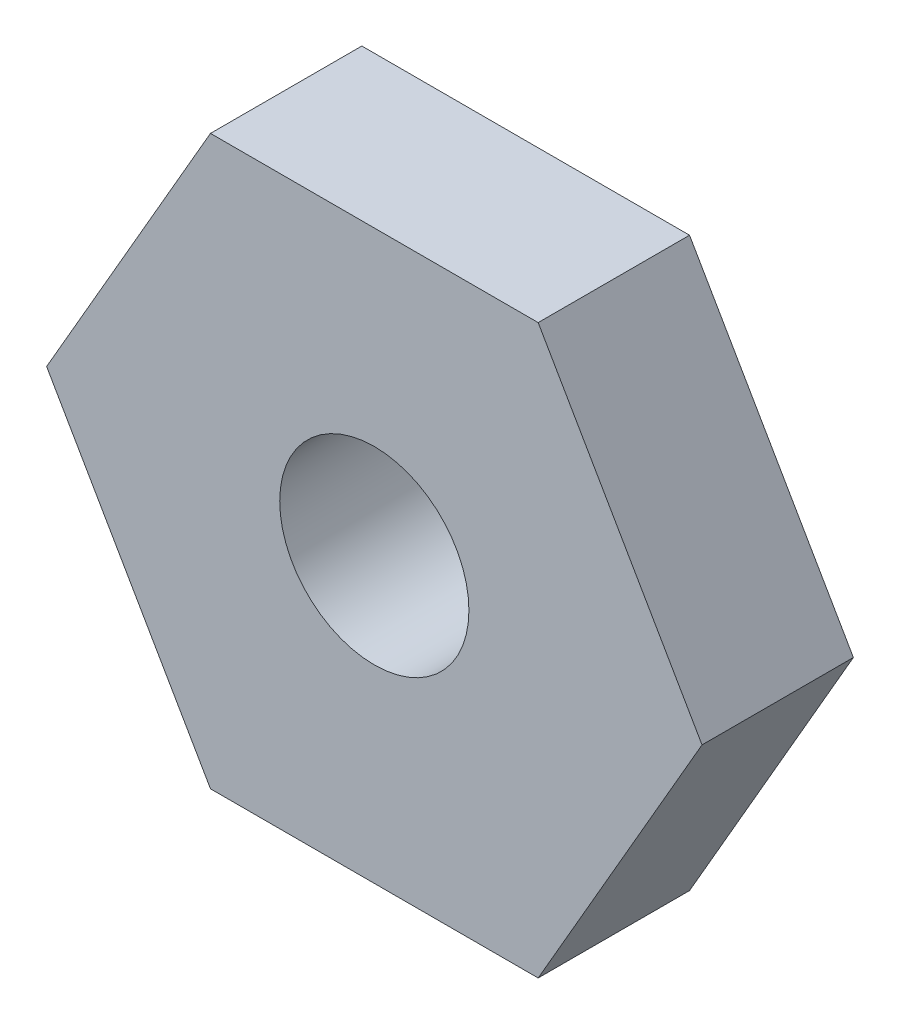
from build123d import *

# Parameters (mm, degrees)
EXTRUDE_START       = -4
EXTRUDE_1_DEPTH     = 8
SKETCH_2_R          = 5
CUT_EXTRUDE_1_DEPTH = 25.269322199


# Read off the part's stored shape, not the designer's step: 凸台-拉伸1
with BuildPart() as part:
    # 凸台-拉伸1 outline → 凸台-拉伸1 (new body)
    with BuildSketch(Plane.XY.offset(EXTRUDE_START)):
        Polygon((8.660254038, -15), (17.320508076, 0), (8.660254038, 15), (-8.660254038, 15), (-17.320508076, 0), (-8.660254038, -15), align=None)
    extrude(amount=EXTRUDE_1_DEPTH)

    # 草图2 → 切除-拉伸1 (cut, through all)
    with BuildSketch(Plane.XY.offset(4)):
        Circle(SKETCH_2_R)
    extrude(amount=-CUT_EXTRUDE_1_DEPTH, mode=Mode.SUBTRACT)


solid = part.part
